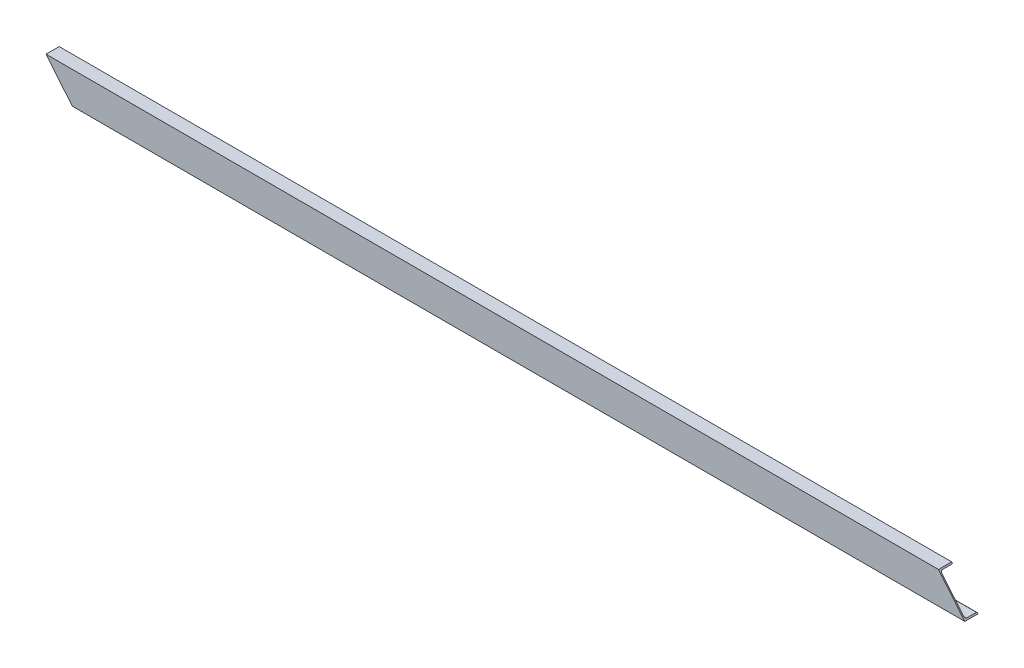
from build123d import *

# Parameters (mm, degrees)
EXTRUDE_1_DEPTH       = 4035.471751559
EXTRUDE_START         = 3020
EXTRUDE_1_2_OUTLINE_W = 184
EXTRUDE_1_2_OUTLINE_H = 61
EXTRUDE_1_2_DEPTH     = 90
CUT_EXTRUDE_1_DEPTH   = 4039.570438432


with BuildPart() as part:
    # Бобышка-Вытянуть1: read off the stored shape, not the designer's step
    # Бобышка-Вытянуть1 outline → Бобышка-Вытянуть1 (new body)
    with BuildSketch(Plane(origin=(0, 0, 0), x_dir=(0, 0, -1), z_dir=(1, 0, 0))):
        with BuildLine():
            Line((-58, -7.156136611), (-58, -147.156136611))
            Line((-58, -147.156136611), (0, -147.156136611))
            Line((0, -147.156136611), (0, -145.256136611))
            ThreePointArc((0, -145.256136611), (-0.878679657, -143.134816267), (-3, -142.256136611))
            Line((-3, -142.256136611), (-45.1, -142.256136611))
            ThreePointArc((-45.1, -142.256136611), (-50.75685425, -139.912990861), (-53.1, -134.256136611))
            Line((-53.1, -134.256136611), (-53.1, -20.056136611))
            ThreePointArc((-53.1, -20.056136611), (-50.756854249, -14.399282362), (-45.1, -12.056136611))
            Line((-45.1, -12.056136611), (-3, -12.056136611))
            ThreePointArc((-3, -12.056136611), (-0.878679656, -11.177456955), (0, -9.056136611))
            Line((0, -9.056136611), (0, -7.156136611))
            Line((0, -7.156136611), (-58, -7.156136611))
        make_face()
    extrude(amount=EXTRUDE_1_DEPTH)

    # Extrude 1 2 outline → Extrude 1 2 (cut)
    with BuildSketch(Plane(origin=(0, 0, 0), x_dir=(0.6361549011998189, -0.7715613661138359, 0), z_dir=(0.7715613661138359, 0.636154901199819, 0)).offset(EXTRUDE_START)):
        with Locations((2590, -28.5)):
            Rectangle(EXTRUDE_1_2_OUTLINE_W, EXTRUDE_1_2_OUTLINE_H)
    extrude(amount=EXTRUDE_1_2_DEPTH, mode=Mode.SUBTRACT)

    # Эскиз2 → Вырез-Вытянуть1 (cut, through all)
    with BuildSketch(Plane.XY.offset(58)):
        Polygon((0, -7.156136611), (115.430463576, -147.156136611), (0, -147.156136611), align=None)
    extrude(amount=-CUT_EXTRUDE_1_DEPTH, mode=Mode.SUBTRACT)


solid = part.part
